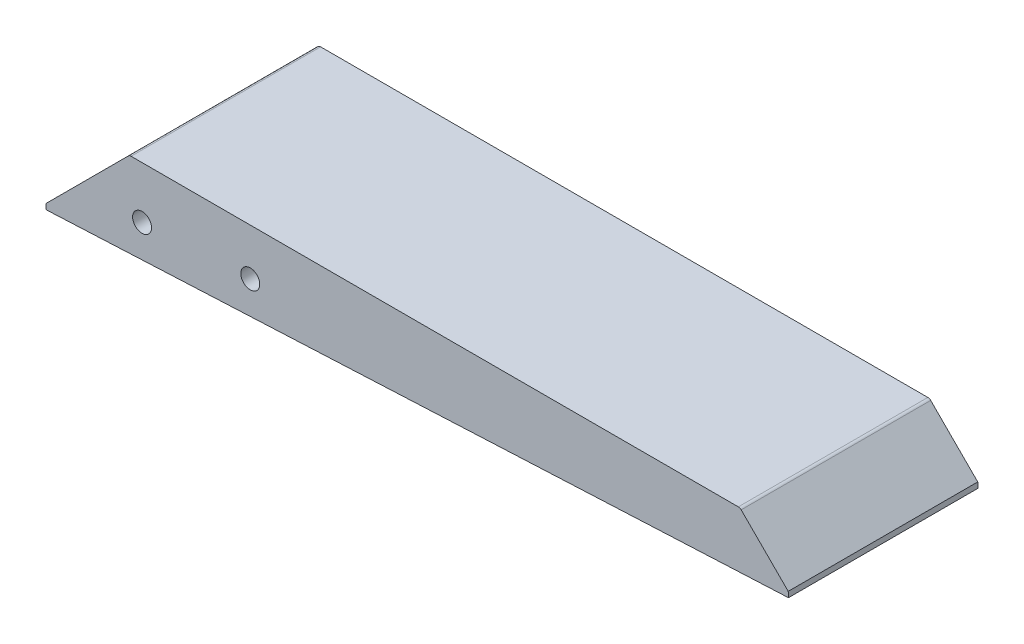
from build123d import *

# Parameters (mm, degrees)
EXTRUDE_1_DEPTH     = 35
SKETCH_2_W          = 137.22254317
SKETCH_2_H          = 35
SKETCH_2_W_2        = 134.22254317
SKETCH_2_H_2        = 32
EXTRUDE_2_DEPTH     = 1
FILLET_1_R          = 2
SKETCH_3_R          = 1.75
CUT_EXTRUDE_1_DEPTH = 6.2
CUT_EXTRUDE_START   = -6.55
SKETCH_4_R          = 1.75
CUT_EXTRUDE_2_DEPTH = 6.55
EXTRUDE_3_DEPTH     = 1


with BuildPart() as part:
    # 草图1 → 凸台-拉伸1 (new body)
    with BuildSketch(Plane.XY):
        with BuildLine():
            Line((29.763864432, 1.094424801), (166.832374142, 7.594424801))
            Line((166.832374142, 7.594424801), (158.142544089, 16.284254855))
            ThreePointArc((158.142544089, 16.284254855), (157.90357385, 16.443929664), (157.621689234, 16.5))
            Line((157.621689234, 16.5), (45.474549341, 16.5))
            ThreePointArc((45.474549341, 16.5), (45.192664725, 16.443929664), (44.953694486, 16.284254855))
            Line((44.953694486, 16.284254855), (29.763864432, 1.094424801))
        make_face()
    extrude(amount=-EXTRUDE_1_DEPTH)

    # 草图2 → 凸台-拉伸2 (add)
    with BuildSketch(Plane(origin=(0.015000012, -0.316312203, 0), x_dir=(0.9988774915788264, 0.04736831026320678, 0), z_dir=(0.04736831026320678, -0.9988774915788264, 0))):
        with Locations((98.393566883, -17.5)):
            Rectangle(SKETCH_2_W, SKETCH_2_H)
        with Locations((98.393566883, -17.5)):
            Rectangle(SKETCH_2_W_2, SKETCH_2_H_2, mode=Mode.SUBTRACT)
    extrude(amount=EXTRUDE_2_DEPTH)

    # 圆角1
    fillet_1_edges = [part.edges().sort_by_distance(p)[0] for p in [
        (31.285864825, 0.666038521, -33.5),
        (165.35774206, 7.02393359, -33.5),
        (165.35774206, 7.02393359, -1.5),
        (31.285864825, 0.666038521, -1.5),
    ]]
    fillet(fillet_1_edges, radius=FILLET_1_R)

    # 草图3 → 切除-拉伸1 (cut)
    with BuildSketch(Plane.XY):
        with Locations((47.50681773, 6.941441844)):
            Circle(SKETCH_3_R)
        with Locations((67.484203152, 7.892268689)):
            Circle(SKETCH_3_R)
    extrude(amount=-CUT_EXTRUDE_1_DEPTH, mode=Mode.SUBTRACT)

    # 草图4 → 切除-拉伸2 (cut)
    with BuildSketch(Plane(origin=(0, 0, -35), x_dir=(-1, 0, 0), z_dir=(0, 0, -1)).offset(CUT_EXTRUDE_START)):
        with Locations((-47.50681773, 6.941441844)):
            Circle(SKETCH_4_R)
        with Locations((-67.484203152, 7.892268689)):
            Circle(SKETCH_4_R)
    extrude(amount=CUT_EXTRUDE_2_DEPTH, mode=Mode.SUBTRACT)

    # 草图6 → 凸台-拉伸3 (add)
    # profile 1 of 11: a face of its own
    with BuildSketch(Plane(origin=(0.015000012, -0.316312203, 0), x_dir=(0.9988774915788264, 0.04736831026320678, 0), z_dir=(0.04736831026320678, -0.9988774915788264, 0))):
        Polygon((144.533247979, -18.341711689), (144.298447979, -18.200811689), (143.922747979, -18.294711689), (142.795647979, -19.468811689), (142.279047979, -19.891511689), (142.138147979, -19.891511689), (142.091147979, -19.750611689), (142.654747979, -18.247811689), (142.701647979, -17.825111689), (142.466847979, -17.496311689), (141.997247979, -17.449411689), (141.668447979, -17.731211689), (141.245747979, -18.388711689), (140.259547979, -19.374911689), (139.226347979, -20.126311689), (138.803647979, -20.314211689), (138.615747979, -20.314211689), (138.521847979, -20.220311689), (138.521847979, -19.985411689), (138.662747979, -19.609711689), (139.461147979, -18.435611689), (139.461147979, -18.106911689), (139.273247979, -17.872011689), (139.038447979, -17.778111689), (138.662747979, -17.872011689), (138.005247979, -18.623511689), (137.582547979, -19.327911689), (137.347747979, -20.126311689), (137.347747979, -20.408111689), (137.488647979, -20.783811689), (137.911347979, -21.159511689), (138.193147979, -21.253511689), (138.756647979, -21.253511689), (139.695947979, -20.877811689), (140.635247979, -20.173311689), (140.776147979, -20.220311689), (140.635247979, -20.830811689), (140.541347979, -20.924711689), (138.521847979, -21.817011689), (137.958247979, -22.192811689), (137.629547979, -22.521511689), (137.441647979, -22.850311689), (137.441647979, -23.272911689), (137.676547979, -23.648711689), (138.005247979, -23.883511689), (138.380947979, -24.024411689), (139.179347979, -24.071311689), (139.836847979, -23.883511689), (140.447347979, -23.507811689), (141.010947979, -22.850311689), (141.480647979, -21.817011689), (141.621547979, -21.300411689), (142.842547979, -20.596011689), (143.734847979, -19.844511689), (144.486347979, -18.952211689), (144.580247979, -18.764411689), align=None)
        Polygon((140.212547979, -21.957911689), (140.212547979, -22.098811689), (140.024747979, -22.474511689), (139.555047979, -22.991211689), (139.085447979, -23.226011689), (138.662747979, -23.226011689), (138.521847979, -23.085111689), (138.568847979, -22.850311689), (138.803647979, -22.568511689), (140.071647979, -21.911011689), align=None, mode=Mode.SUBTRACT)
    # profile 2 of 11: a face of its own
    with BuildSketch(Plane(origin=(0.015000012, -0.316312203, 0), x_dir=(0.9988774915788264, 0.04736831026320678, 0), z_dir=(0.04736831026320678, -0.9988774915788264, 0))):
        Polygon((156.978847979, -14.866311689), (156.744047979, -14.725411689), (156.415247979, -14.725411689), (156.133447979, -14.913311689), (156.039547979, -15.148111689), (155.992547979, -16.087411689), (155.569847979, -17.167611689), (154.771547979, -18.341711689), (153.973147979, -19.046211689), (153.691347979, -18.999211689), (153.691347979, -18.341711689), (153.879147979, -17.731211689), (153.879147979, -17.308511689), (153.691347979, -17.073611689), (153.503447979, -16.979711689), (153.268647979, -16.979711689), (153.033847979, -17.073611689), (152.845947979, -17.261511689), (152.376347979, -18.106911689), (151.390047979, -19.140111689), (151.108247979, -19.327911689), (150.920447979, -19.281011689), (150.967347979, -18.905311689), (151.202247979, -18.247811689), (152.000647979, -16.791911689), (151.953647979, -16.369211689), (151.577947979, -16.134411689), (151.202247979, -16.228311689), (150.920447979, -16.510111689), (150.122047979, -17.872011689), (149.887247979, -18.623511689), (149.041847979, -19.421911689), (148.478247979, -19.844511689), (148.243447979, -19.938511689), (147.961647979, -19.938511689), (147.726847979, -19.797611689), (147.351147979, -19.421911689), (147.351147979, -19.281011689), (149.182747979, -17.543311689), (149.276647979, -17.355411689), (149.276647979, -17.120611689), (149.041847979, -16.838811689), (148.666147979, -16.791911689), (148.337347979, -16.932811689), (146.646647979, -18.482611689), (146.505747979, -18.482611689), (145.660447979, -17.543311689), (145.190747979, -17.496311689), (145.002947979, -17.590311689), (144.815047979, -17.825111689), (144.815047979, -18.106911689), (145.754347979, -19.281011689), (145.754347979, -19.374911689), (144.110647979, -21.206511689), (143.922747979, -21.582211689), (143.969747979, -21.864011689), (144.251547979, -22.098811689), (144.580247979, -22.098811689), (144.815047979, -22.004911689), (146.458847979, -20.220311689), (146.599747979, -20.220311689), (147.069347979, -20.642911689), (147.492047979, -20.877811689), (148.290447979, -20.924711689), (149.088847979, -20.549011689), (149.746347979, -19.938511689), (149.887247979, -19.938511689), (150.169047979, -20.267211689), (150.403847979, -20.408111689), (150.920447979, -20.455111689), (151.249147979, -20.361111689), (151.812747979, -20.032411689), (152.517247979, -19.374911689), (152.658147979, -19.421911689), (152.752047979, -19.656711689), (153.033847979, -19.938511689), (153.456547979, -20.126311689), (154.067047979, -20.079411689), (154.536647979, -19.891511689), (155.288147979, -19.327911689), (155.757747979, -18.858311689), (156.274347979, -18.153811689), (156.744047979, -17.308511689), (157.119747979, -16.040411689), (157.119747979, -15.195111689), align=None)
    # profile 3 of 11: a face of its own
    with BuildSketch(Plane(origin=(0.015000012, -0.316312203, 0), x_dir=(0.9988774915788264, 0.04736831026320678, 0), z_dir=(0.04736831026320678, -0.9988774915788264, 0))):
        Polygon((103.178, -10.815686264), (102.5205, -10.486886264), (101.7221, -10.252086264), (100.2192, -10.252086264), (99.5148, -10.533886264), (99.0921, -10.862586264), (97.4014, -11.614086264), (95.8985, -12.130686264), (94.8653, -12.271586264), (94.6305, -12.459386264), (94.5365, -12.647286264), (94.5835, -12.929086264), (95.0531, -13.398686264), (95.4289, -13.586586264), (96.0864, -13.774386264), (97.6362, -13.774386264), (97.824, -14.103186264), (97.871, -14.995486264), (97.7771, -15.324186264), (96.556, -15.793886264), (95.8046, -16.263486264), (94.9592, -15.981686264), (94.4896, -15.981686264), (94.1608, -16.122586264), (94.0199, -16.263486264), (93.926, -16.545286264), (94.2078, -17.484586264), (94.2548, -18.893486264), (94.3956, -19.738886264), (94.6305, -20.396386264), (94.9123, -20.865986264), (95.4758, -21.429586264), (95.9924, -21.664386264), (96.603, -21.711386264), (97.3544, -21.476586264), (97.5423, -21.476586264), (97.5892, -21.664386264), (97.4483, -22.321886264), (97.2605, -22.791586264), (96.7908, -23.355086264), (95.1471, -23.824786264), (93.6442, -24.106586264), (92.7519, -24.153486264), (92.4701, -24.294386264), (92.1883, -24.623186264), (92.0944, -25.092786264), (92.3292, -25.656386264), (92.7519, -26.079086264), (93.4094, -26.454786264), (93.973, -26.642586264), (95.5228, -26.642586264), (96.4621, -26.407786264), (100.5949, -24.904986264), (102.9431, -24.200486264), (103.3658, -24.247486264), (103.9764, -25.280686264), (104.446, -25.703386264), (104.9156, -25.938186264), (105.3853, -26.032086264), (105.9019, -25.985086264), (106.4185, -25.750286264), (106.7942, -25.374586264), (107.029, -24.764086264), (107.029, -24.200486264), (106.8881, -23.683886264), (106.5594, -23.120286264), (105.8549, -22.368886264), (104.9156, -21.711386264), (103.8824, -21.241686264), (103.178, -21.053886264), (102.6144, -21.100886264), (102.4265, -21.194786264), (102.2387, -21.476586264), (102.3326, -21.852286264), (102.6144, -22.180986264), (102.5205, -22.368886264), (101.2524, -22.556686264), (100.2662, -22.791586264), (99.9374, -22.744586264), (99.9374, -22.603686264), (100.2662, -21.946186264), (100.5949, -20.772086264), (100.7358, -20.678186264), (101.5342, -20.490286264), (102.8492, -20.349386264), (103.5067, -20.114586264), (103.8355, -19.785886264), (103.9764, -19.457086264), (104.5399, -18.658686264), (105.3383, -17.014986264), (105.3383, -16.357486264), (105.2444, -16.075686264), (105.0096, -15.699986264), (104.1642, -14.995486264), (103.6006, -14.713686264), (102.5674, -14.431886264), (101.5812, -14.431886264), (101.2524, -14.525886264), (100.8298, -14.478886264), (100.7828, -13.962286264), (100.6889, -13.774386264), (100.6889, -13.633486264), (100.7828, -13.539586264), (103.2249, -12.929086264), (103.7885, -12.459386264), (103.9294, -12.130686264), (103.8824, -11.614086264), (103.7415, -11.332286264), align=None)
        Polygon((97.7301, -17.296686264), (97.7301, -19.316186264), (97.4014, -19.550986264), (96.8848, -19.597986264), (96.6969, -19.457086264), (96.556, -19.034386264), (96.509, -17.907286264), (96.6499, -17.766386264), (97.5892, -17.296686264), align=None, mode=Mode.SUBTRACT)
        Polygon((101.816, -16.357486264), (102.0508, -16.545286264), (102.0978, -16.686186264), (102.0508, -17.061886264), (101.863, -17.578486264), (101.3933, -18.376886264), (101.0646, -18.611786264), (100.7828, -18.658686264), (100.7358, -18.189086264), (100.8298, -16.592286264), (100.9237, -16.498386264), (101.2524, -16.404386264), align=None, mode=Mode.SUBTRACT)
    # profile 4 of 11: a face of its own
    with BuildSketch(Plane(origin=(0.015000012, -0.316312203, 0), x_dir=(0.9988774915788264, 0.04736831026320678, 0), z_dir=(0.04736831026320678, -0.9988774915788264, 0))):
        Polygon((128.0221, -9.970286264), (127.5524, -9.923386264), (126.9419, -10.299086264), (124.7815, -12.459386264), (124.6406, -12.459386264), (123.2787, -10.862586264), (122.9969, -10.721786264), (122.7151, -10.721786264), (122.3394, -10.956586264), (122.2455, -11.332286264), (122.3864, -11.660986264), (123.7483, -13.398686264), (123.7483, -13.539586264), (122.1515, -15.418186264), (121.541, -16.310486264), (121.3062, -16.780086264), (121.3062, -17.155886264), (121.4471, -17.390686264), (121.7289, -17.531586264), (122.0106, -17.531586264), (122.2455, -17.437586264), (122.4803, -17.202786264), (123.1378, -16.216586264), (124.5937, -14.478886264), (124.7346, -14.478886264), (125.439, -15.089386264), (125.9556, -15.418186264), (126.4253, -15.465086264), (126.754, -15.277286264), (126.848, -15.089386264), (126.801, -14.713686264), (125.5799, -13.539586264), (125.5799, -13.445686264), (128.069, -10.862586264), (128.2569, -10.533886264), (128.2569, -10.299086264), align=None)
    # profile 5 of 11: a face of its own
    with BuildSketch(Plane(origin=(0.015000012, -0.316312203, 0), x_dir=(0.9988774915788264, 0.04736831026320678, 0), z_dir=(0.04736831026320678, -0.9988774915788264, 0))):
        Polygon((132.2489, -9.547586264), (131.8262, -9.406686264), (131.4505, -9.406686264), (130.9339, -9.547586264), (130.4642, -9.829386264), (130.3233, -9.829386264), (130.2764, -9.406686264), (129.9476, -9.077986264), (129.5719, -9.077986264), (129.384, -9.171886264), (129.1962, -9.406686264), (128.2099, -12.177586264), (127.3646, -15.277286264), (126.848, -18.001186264), (126.848, -18.611786264), (127.0828, -18.940486264), (127.5055, -19.034386264), (127.7403, -18.940486264), (127.9751, -18.658686264), (128.2099, -17.108886264), (128.7735, -14.760686264), (129.6189, -14.713686264), (130.5112, -14.244086264), (130.8869, -13.962286264), (131.6853, -13.163886264), (132.3898, -12.130686264), (132.7185, -11.285286264), (132.8124, -10.533886264), (132.6246, -9.923386264), align=None)
        Polygon((131.5444, -10.439986264), (131.6383, -10.674786264), (131.5914, -11.003486264), (131.4505, -11.426186264), (130.9808, -12.224586264), (130.0885, -13.210886264), (129.6658, -13.539586264), (129.1962, -13.727486264), (129.1492, -13.492586264), (129.431, -12.741186264), (130.0415, -11.660986264), (130.8399, -10.768686264), (131.3565, -10.439986264), align=None, mode=Mode.SUBTRACT)
    # profile 6 of 11: a face of its own
    with BuildSketch(Plane(origin=(0.015000012, -0.316312203, 0), x_dir=(0.9988774915788264, 0.04736831026320678, 0), z_dir=(0.04736831026320678, -0.9988774915788264, 0))):
        Polygon((46.3512, -7.669086264), (46.2103, -8.044786264), (46.2103, -8.326586264), (46.4921, -8.890086264), (47.0556, -9.453686264), (48.6524, -10.674786264), (48.5115, -11.238386264), (47.8071, -12.741186264), (47.8071, -13.022986264), (47.9949, -13.210886264), (48.4176, -13.210886264), (49.3569, -12.553386264), (50.3431, -12.036786264), (50.8128, -11.895886264), (51.3764, -11.895886264), (51.9399, -11.754986264), (52.5974, -11.379186264), (52.9262, -11.050486264), (53.161, -10.674786264), (53.3019, -10.017286264), (53.161, -9.453686264), (52.9731, -9.124986264), (52.4565, -8.561386264), (52.0808, -8.279586264), (50.9537, -7.669086264), (49.8735, -7.293386264), (48.6524, -7.058486264), (47.1965, -7.105486264), (46.7269, -7.293386264), align=None)
    # profile 7 of 11: a face of its own
    with BuildSketch(Plane(origin=(0.015000012, -0.316312203, 0), x_dir=(0.9988774915788264, 0.04736831026320678, 0), z_dir=(0.04736831026320678, -0.9988774915788264, 0))):
        Polygon((154.2281, -7.434186264), (154.0403, -7.199386264), (153.6646, -7.199386264), (152.0678, -8.279586264), (151.5042, -8.514386264), (151.1755, -8.561386264), (151.0815, -8.467486264), (151.0815, -8.326586264), (151.5042, -7.011586264), (151.4573, -6.494986264), (151.2224, -6.213186264), (150.9876, -6.119286264), (150.518, -6.166186264), (150.0014, -6.447986264), (149.2969, -7.058486264), (149.156, -7.011586264), (149.109, -6.635886264), (148.9212, -6.447986264), (148.4515, -6.400986264), (148.2167, -6.541886264), (148.0289, -6.823686264), (147.5123, -8.044786264), (146.7139, -8.890086264), (145.9624, -9.547586264), (145.8685, -9.547586264), (145.8215, -9.312786264), (146.573, -7.387286264), (146.573, -7.152486264), (146.3851, -6.870686264), (146.1973, -6.776686264), (145.9155, -6.776686264), (145.7276, -6.870686264), (145.4928, -7.152486264), (144.7883, -8.749186264), (144.6005, -9.500686264), (144.6005, -10.205086264), (144.9292, -10.674786264), (145.258, -10.815686264), (145.5398, -10.815686264), (146.0564, -10.627786264), (147.0896, -9.782486264), (147.2305, -9.782486264), (147.3244, -9.970286264), (147.5123, -10.111186264), (147.9819, -10.111186264), (148.3576, -9.782486264), (148.7333, -9.218886264), (149.8135, -7.950886264), (149.9544, -7.997786264), (149.9074, -8.796186264), (150.0014, -9.077986264), (150.2362, -9.359786264), (150.7998, -9.594586264), (151.6451, -9.500686264), (152.6314, -9.077986264), (153.5237, -8.514386264), (153.9464, -8.138686264), (154.2281, -7.762986264), align=None)
    # profile 8 of 11: a face of its own
    with BuildSketch(Plane(origin=(0.015000012, -0.316312203, 0), x_dir=(0.9988774915788264, 0.04736831026320678, 0), z_dir=(0.04736831026320678, -0.9988774915788264, 0))):
        Polygon((132.8594, -12.882086264), (133.0003, -13.210886264), (133.2351, -13.445686264), (133.5639, -13.586586264), (133.8926, -13.586586264), (134.644, -13.210886264), (135.5364, -12.318486264), (135.6303, -12.318486264), (135.7712, -12.506386264), (136.006, -12.647286264), (136.5226, -12.647286264), (136.7574, -12.553386264), (137.0862, -12.318486264), (137.9315, -11.426186264), (138.0255, -11.426186264), (138.1664, -11.707986264), (138.4012, -11.895886264), (139.0117, -11.942786264), (139.6223, -11.567086264), (140.0449, -11.144386264), (140.7964, -10.205086264), (141.3599, -9.359786264), (142.0174, -9.688486264), (143.0976, -9.829386264), (143.1915, -10.017286264), (142.7689, -10.392986264), (142.0174, -10.674786264), (141.7356, -10.674786264), (141.4069, -10.392986264), (141.1721, -10.392986264), (140.9842, -10.486886264), (140.7964, -10.674786264), (140.7024, -10.909586264), (140.7024, -11.144386264), (140.7964, -11.332286264), (140.9842, -11.520086264), (141.5478, -11.707986264), (142.2992, -11.660986264), (143.1915, -11.332286264), (143.7081, -11.003486264), (144.1778, -10.533886264), (144.4126, -10.064186264), (144.4126, -9.735486264), (144.2248, -9.312786264), (143.943, -9.077986264), (143.2855, -8.843186264), (142.534, -8.749186264), (142.4871, -8.467486264), (143.0506, -7.950886264), (143.1915, -7.997786264), (143.2385, -8.232586264), (143.4264, -8.373486264), (143.849, -8.326586264), (144.1308, -8.091786264), (144.4126, -7.669086264), (144.4596, -7.293386264), (144.3656, -7.058486264), (144.2248, -6.917586264), (143.896, -6.776686264), (143.4264, -6.776686264), (142.8158, -6.964586264), (142.1583, -7.340286264), (141.4069, -8.091786264), (140.8903, -8.467486264), (139.2465, -10.533886264), (139.1056, -10.486886264), (139.1056, -10.345986264), (139.4344, -9.218886264), (139.4344, -8.702286264), (139.1526, -8.420486264), (138.683, -8.467486264), (138.4481, -8.702286264), (138.0724, -9.594586264), (137.7437, -10.111186264), (136.8044, -11.238386264), (136.6635, -11.191386264), (136.6635, -11.050486264), (137.0392, -10.064186264), (137.274, -9.641586264), (137.321, -9.124986264), (137.0862, -8.843186264), (136.9453, -8.796186264), (136.5226, -8.890086264), (136.1469, -9.406686264), (135.7712, -10.158186264), (135.5364, -10.862586264), (135.0198, -11.473186264), (134.1274, -12.365486264), (134.0335, -12.365486264), (133.9865, -12.083686264), (134.0805, -11.520086264), (134.4092, -10.299086264), (135.4424, -7.809986264), (136.006, -6.025286264), (136.006, -5.696586264), (135.7712, -5.367786264), (135.2076, -5.367786264), (134.9258, -5.649586264), (134.5031, -6.400986264), (134.1274, -7.246386264), (133.4699, -9.124986264), (133.0473, -10.721786264), (132.8594, -11.754986264), align=None)
    # profile 9 of 11: a face of its own
    with BuildSketch(Plane(origin=(0.015000012, -0.316312203, 0), x_dir=(0.9988774915788264, 0.04736831026320678, 0), z_dir=(0.04736831026320678, -0.9988774915788264, 0))):
        Polygon((146.9956, -4.898186264), (146.573, -4.898186264), (146.1033, -5.320886264), (145.8215, -5.931386264), (145.8685, -6.260086264), (146.0564, -6.494986264), (146.4321, -6.588886264), (146.7608, -6.447986264), (147.1365, -5.931386264), (147.3244, -5.367786264), (147.2305, -5.085986264), align=None)
    # profile 10 of 11: a face of its own
    with BuildSketch(Plane(origin=(0.015000012, -0.316312203, 0), x_dir=(0.9988774915788264, 0.04736831026320678, 0), z_dir=(0.04736831026320678, -0.9988774915788264, 0))):
        Polygon((83.1712, -24.294386264), (82.9833, -24.012586264), (82.7955, -23.918686264), (82.4198, -23.918686264), (76.0796, -25.186786264), (73.6844, -25.562486264), (71.1483, -25.844186264), (69.6455, -25.938186264), (67.1094, -25.938186264), (65.1839, -25.797286264), (64.7142, -25.703386264), (64.7612, -25.562486264), (65.2778, -25.562486264), (66.264, -25.186786264), (67.2033, -24.341386264), (67.579, -23.824786264), (68.0956, -22.791586264), (68.3774, -22.040086264), (68.7062, -20.772086264), (68.941, -19.316186264), (69.1758, -19.316186264), (70.209, -19.738886264), (71.7119, -20.490286264), (74.5767, -22.134086264), (75.9856, -22.603686264), (76.9719, -22.603686264), (77.6764, -22.321886264), (78.099, -21.946186264), (78.3808, -21.382586264), (78.3808, -20.772086264), (78.2869, -20.443386264), (77.8173, -19.738886264), (77.3476, -19.316186264), (75.9856, -18.517786264), (74.3419, -17.907286264), (72.6512, -17.484586264), (70.5848, -17.155886264), (69.1289, -17.061886264), (68.894, -16.967986264), (68.941, -16.827086264), (70.8196, -16.122586264), (72.1815, -15.418186264), (73.3556, -14.619786264), (74.201, -13.774386264), (74.4828, -13.257786264), (74.5298, -12.506386264), (74.248, -11.895886264), (73.6844, -11.379186264), (73.2148, -11.144386264), (72.5573, -10.956586264), (71.524, -10.956586264), (70.6787, -11.238386264), (70.3969, -11.614086264), (70.4908, -11.942786264), (70.6787, -12.130686264), (70.6787, -12.365486264), (70.5378, -12.647286264), (69.5985, -13.821386264), (69.0349, -14.384986264), (68.0956, -15.136386264), (67.9078, -15.042486264), (67.579, -14.525886264), (66.6398, -13.633486264), (66.0762, -13.257786264), (65.1369, -12.835086264), (65.1369, -12.741186264), (66.5928, -11.379186264), (67.2503, -10.580886264), (67.4381, -10.158186264), (67.4381, -9.641586264), (67.1564, -9.124986264), (67.2033, -8.984086264), (70.5848, -7.762986264), (71.1483, -7.481186264), (71.571, -7.058486264), (71.7589, -6.729786264), (71.7589, -5.837486264), (71.524, -5.414786264), (70.9135, -4.898186264), (70.256, -4.616386264), (69.7864, -4.522486264), (68.894, -4.522486264), (68.1896, -4.663386264), (67.3912, -4.945086264), (62.7417, -7.152486264), (60.2526, -8.185686264), (57.9983, -8.890086264), (56.8712, -9.077986264), (56.3076, -9.077986264), (56.0258, -9.218886264), (55.8849, -9.453686264), (55.9789, -9.829386264), (56.4485, -10.205086264), (56.9181, -10.439986264), (57.8105, -10.674786264), (58.7498, -10.768686264), (59.9239, -10.721786264), (61.1919, -10.533886264), (61.8494, -10.345986264), (62.0373, -10.345986264), (62.0842, -10.533886264), (61.2858, -11.520086264), (60.0648, -12.741186264), (59.1255, -13.539586264), (57.9983, -14.384986264), (56.8712, -15.089386264), (56.0258, -15.512086264), (55.5092, -15.652986264), (55.3214, -15.793886264), (55.2274, -16.075686264), (55.4153, -16.310486264), (55.744, -16.451386264), (56.3546, -16.498386264), (57.9514, -16.263486264), (58.8437, -16.028686264), (59.8299, -15.652986264), (60.0648, -15.699986264), (59.9708, -15.981686264), (59.6421, -16.357486264), (58.1392, -17.672486264), (56.4485, -18.846586264), (55.838, -19.175286264), (55.3214, -19.316186264), (55.0865, -19.644986264), (55.1805, -19.926786264), (55.6501, -20.255486264), (56.1667, -20.396386264), (57.106, -20.396386264), (57.5756, -20.302486264), (58.5149, -19.973686264), (59.3603, -19.550986264), (60.5344, -18.752586264), (61.6146, -17.813386264), (61.7555, -17.813386264), (61.8494, -17.907286264), (61.8964, -18.142086264), (61.4267, -18.846586264), (60.6283, -19.691886264), (58.7967, -21.194786264), (57.7165, -21.899186264), (56.2606, -22.650686264), (55.3214, -23.026386264), (54.476, -23.261186264), (54.2881, -23.495986264), (54.3351, -23.683886264), (54.6639, -23.918686264), (55.1805, -24.012586264), (56.4015, -23.918686264), (58.2331, -23.542986264), (60.7223, -22.650686264), (61.098, -23.402086264), (62.0842, -24.482286264), (62.9765, -25.092786264), (63.5871, -25.374586264), (64.0098, -25.468486264), (64.0098, -25.656386264), (54.2881, -24.294386264), (51.4703, -24.059586264), (51.4233, -23.918686264), (51.893, -23.589986264), (52.4565, -22.932486264), (52.6444, -22.509786264), (52.6914, -21.993186264), (52.4565, -21.335686264), (51.3294, -19.879786264), (51.2355, -19.550986264), (51.2355, -19.081386264), (51.3294, -18.752586264), (51.7051, -18.095086264), (53.208, -16.451386264), (53.3958, -16.028686264), (53.3958, -15.699986264), (53.3019, -15.371186264), (53.114, -15.089386264), (52.6914, -14.713686264), (52.2217, -14.478886264), (51.4703, -14.290986264), (50.531, -14.290986264), (49.8265, -14.478886264), (49.4978, -14.666786264), (49.0281, -15.183386264), (46.9617, -16.075686264), (45.4119, -16.592286264), (44.1439, -16.827086264), (43.8151, -17.108886264), (43.6742, -17.390686264), (43.6742, -17.860286264), (43.7681, -18.048186264), (44.1439, -18.423886264), (44.6135, -18.658686264), (45.271, -18.846586264), (46.3981, -18.846586264), (46.9148, -18.752586264), (48.7464, -18.142086264), (48.7933, -18.329986264), (48.5115, -19.175286264), (48.5115, -19.738886264), (48.7464, -20.349386264), (49.4508, -21.288686264), (49.5917, -21.664386264), (49.4508, -22.180986264), (49.0751, -22.603686264), (48.6055, -22.932486264), (47.3844, -23.449086264), (42.0305, -24.341386264), (39.2126, -25.092786264), (38.743, -25.327586264), (38.4142, -25.656386264), (38.2733, -26.032086264), (38.2733, -26.313886264), (38.4612, -26.783486264), (38.743, -27.112286264), (39.2596, -27.487986264), (40.1989, -27.816786264), (41.0442, -27.863686264), (42.1244, -27.581886264), (44.4726, -26.454786264), (46.2103, -25.985086264), (48.1828, -25.750286264), (50.2962, -25.750286264), (52.0808, -25.891186264), (54.5699, -26.266886264), (57.1999, -26.830486264), (64.4794, -28.709086264), (67.5321, -29.366586264), (70.209, -29.742286264), (72.6981, -29.789186264), (74.201, -29.601386264), (75.1873, -29.366586264), (77.0189, -28.709086264), (78.193, -28.145486264), (80.1655, -26.971386264), (81.5744, -25.985086264), (82.3728, -25.327586264), (83.0303, -24.670086264), (83.1712, -24.435286264), align=None)
        Polygon((64.5733, -19.316186264), (64.6203, -19.691886264), (64.4324, -20.959986264), (64.1037, -22.040086264), (63.8219, -22.556686264), (63.3992, -22.885486264), (62.7417, -22.932486264), (62.0373, -22.697586264), (61.5206, -22.415886264), (61.5206, -22.227986264), (62.0373, -21.946186264), (62.8826, -21.335686264), (63.681, -20.584286264), (64.1037, -20.067586264), (64.4324, -19.363186264), align=None, mode=Mode.SUBTRACT)
        Polygon((61.1449, -15.183386264), (62.366, -14.572786264), (62.9296, -14.197086264), (63.1174, -14.197086264), (63.5401, -14.666786264), (64.0098, -15.465086264), (64.2915, -16.216586264), (64.3855, -16.827086264), (64.1976, -16.920986264), (62.366, -17.155886264), (62.319, -16.967986264), (62.5069, -16.592286264), (62.5069, -16.216586264), (62.413, -15.981686264), (62.0373, -15.605986264), (61.8024, -15.465086264), (61.1919, -15.324186264), align=None, mode=Mode.SUBTRACT)
    # profile 11 of 11: a face of its own
    with BuildSketch(Plane(origin=(0.015000012, -0.316312203, 0), x_dir=(0.9988774915788264, 0.04736831026320678, 0), z_dir=(0.04736831026320678, -0.9988774915788264, 0))):
        Polygon((123.2787, -26.032086264), (123.0908, -25.186786264), (122.856, -24.576186264), (122.4803, -23.824786264), (121.6349, -22.462786264), (119.6624, -19.879786264), (118.6292, -18.705686264), (118.0187, -18.235986264), (117.549, -18.282986264), (117.3612, -18.517786264), (117.3612, -18.846586264), (117.9248, -20.396386264), (118.2535, -21.664386264), (118.4414, -22.791586264), (118.4414, -24.106586264), (118.3005, -24.576186264), (118.0656, -24.857986264), (117.7369, -24.998886264), (116.8446, -24.998886264), (115.9053, -24.810986264), (114.919, -24.482286264), (114.1206, -24.106586264), (113.3692, -23.636886264), (112.7117, -23.120286264), (111.7255, -22.087086264), (111.068, -21.100886264), (110.3635, -19.504086264), (109.8939, -17.719386264), (109.706, -16.028686264), (109.753, -14.056186264), (110.0348, -12.083686264), (110.2226, -11.332286264), (110.7392, -9.923386264), (111.6315, -8.185686264), (111.6315, -7.199386264), (111.2089, -6.400986264), (110.4105, -5.602586264), (109.2364, -4.804186264), (108.6728, -4.522486264), (107.7335, -4.193686264), (107.2169, -4.099786264), (105.8549, -4.099786264), (104.399, -4.287586264), (102.4265, -4.663386264), (97.4953, -5.931386264), (95.4289, -6.635886264), (93.879, -7.340286264), (93.2215, -7.762986264), (92.8458, -8.138686264), (92.611, -8.514386264), (92.5171, -8.514386264), (92.1414, -8.185686264), (91.249, -7.809986264), (90.5915, -7.809986264), (90.2158, -7.950886264), (89.8871, -8.232586264), (89.7462, -8.467486264), (89.6523, -8.890086264), (89.6523, -9.312786264), (89.8401, -10.486886264), (89.8401, -13.398686264), (89.7462, -14.760686264), (89.3705, -17.437586264), (88.8069, -19.832786264), (87.8676, -22.556686264), (87.0692, -24.106586264), (86.8814, -24.294386264), (86.6935, -24.200486264), (86.5996, -23.449086264), (86.3178, -23.167286264), (85.989, -23.214286264), (85.5194, -23.777786264), (85.2376, -24.388386264), (85.0028, -25.186786264), (84.9089, -25.844186264), (84.9089, -26.642586264), (85.1437, -27.394086264), (85.7073, -27.957586264), (86.083, -28.098486264), (86.7874, -28.098486264), (87.351, -27.910686264), (88.2433, -27.347086264), (89.1356, -26.501686264), (89.981, -25.421586264), (90.9203, -23.871786264), (91.6248, -22.321886264), (92.3292, -20.349386264), (93.1746, -16.733186264), (93.4094, -15.042486264), (93.5503, -13.257786264), (93.5503, -11.050486264), (93.3624, -9.970286264), (93.4564, -9.782486264), (94.7714, -9.782486264), (100.5949, -7.856886264), (103.5537, -7.105486264), (105.4792, -6.776686264), (106.3246, -6.823686264), (106.5594, -7.058486264), (106.6533, -7.293386264), (106.6533, -8.279586264), (106.2306, -11.520086264), (106.0898, -14.478886264), (106.1837, -17.061886264), (106.5124, -19.128386264), (106.9351, -20.537286264), (107.6865, -22.274986264), (108.6728, -23.871786264), (109.753, -25.186786264), (111.3967, -26.642586264), (112.4299, -27.347086264), (113.8858, -28.145486264), (115.1539, -28.662086264), (116.7976, -29.131786264), (117.8778, -29.319586264), (119.0049, -29.413486264), (119.8033, -29.413486264), (120.9305, -29.272586264), (121.8228, -28.990886264), (122.4803, -28.568186264), (122.856, -28.145486264), (123.1848, -27.440986264), (123.2787, -26.924386264), align=None)
    extrude(amount=EXTRUDE_3_DEPTH)


solid = part.part
